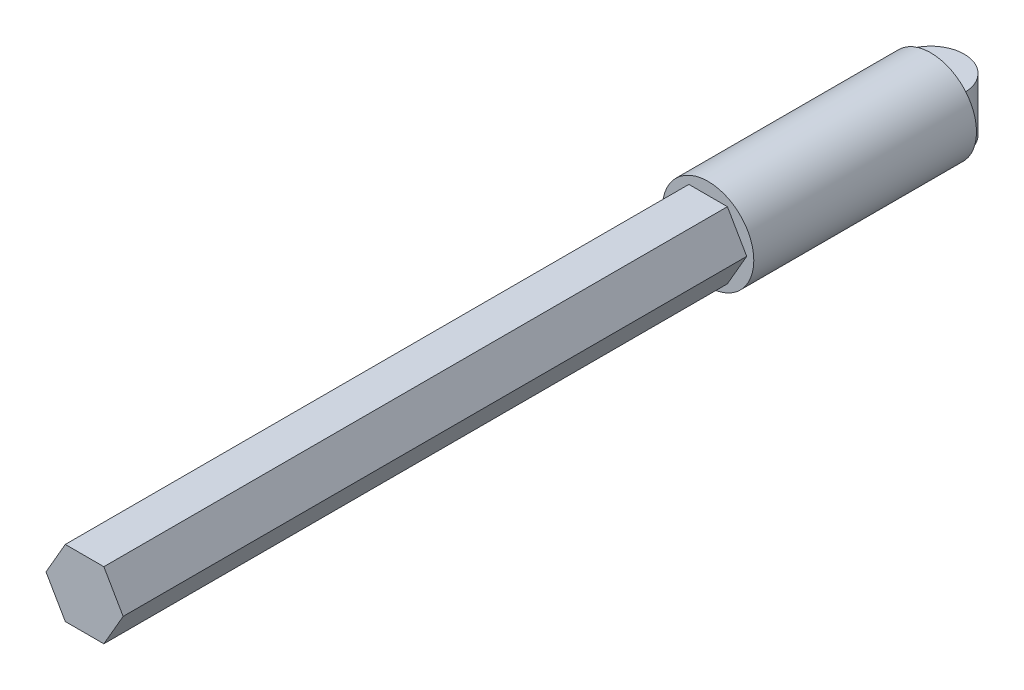
from build123d import *

# Parameters (mm, degrees)
SKETCH1_R                = 1.025
BOSS_EXTRUDE1_DEPTH      = 5
BOSS_EXTRUDE4_DEPTH      = 14
BOSS_EXTRUDE5_DEPTH      = 0.25
BOSS_EXTRUDE5_DEPTH_BACK = 0.2
BOSS_EXTRUDE6_DEPTH      = 0.375
BOSS_EXTRUDE7_START      = 0.375
BOSS_EXTRUDE7_DEPTH      = 0.375


with BuildPart() as part:
    # Sketch1 → Boss-Extrude1 (new body)
    with BuildSketch(Plane.XY):
        Circle(SKETCH1_R)
    extrude(amount=BOSS_EXTRUDE1_DEPTH)

    # Sketch2 → Boss-Extrude4 (add)
    with BuildSketch(Plane.XY.offset(5)):
        Polygon((0.866025404, 0), (0.433012702, 0.75), (-0.433012702, 0.75), (-0.866025404, 0), (-0.433012702, -0.75), (0.433012702, -0.75), align=None)
    extrude(amount=BOSS_EXTRUDE4_DEPTH)

    # Sketch3 → Boss-Extrude5 (add, two sides: drawn at the far end of the back side and taken through both)
    with BuildSketch(Plane(origin=(0, 0, 0), x_dir=(1, 0, 0), z_dir=(0, 1, 0)).offset(-BOSS_EXTRUDE5_DEPTH_BACK)):
        with BuildLine():
            Line((-0.75, 0), (0.75, 0))
            ThreePointArc((0.75, 0), (0, 0.75), (-0.75, 0))
        make_face()
    extrude(amount=BOSS_EXTRUDE5_DEPTH + BOSS_EXTRUDE5_DEPTH_BACK)

    # Sketch5 → Boss-Extrude6 (add)
    with BuildSketch(Plane(origin=(0, 0.25, 0), x_dir=(1, 0, 0), z_dir=(0, 1, 0))):
        with BuildLine():
            ThreePointArc((0.75, 0), (0, 0.75), (-0.75, 0))
            Line((-0.75, 0), (0.75, 0))
        make_face()
    extrude(amount=BOSS_EXTRUDE6_DEPTH)

    # Sketch6 → Boss-Extrude7 (add)
    with BuildSketch(Plane.XZ.offset(0.2).offset(BOSS_EXTRUDE7_START)):
        with BuildLine():
            Line((0.75, 0), (-0.75, 0))
            ThreePointArc((-0.75, 0), (0, -0.75), (0.75, 0))
        make_face()
    extrude(amount=-BOSS_EXTRUDE7_DEPTH)


solid = part.part
